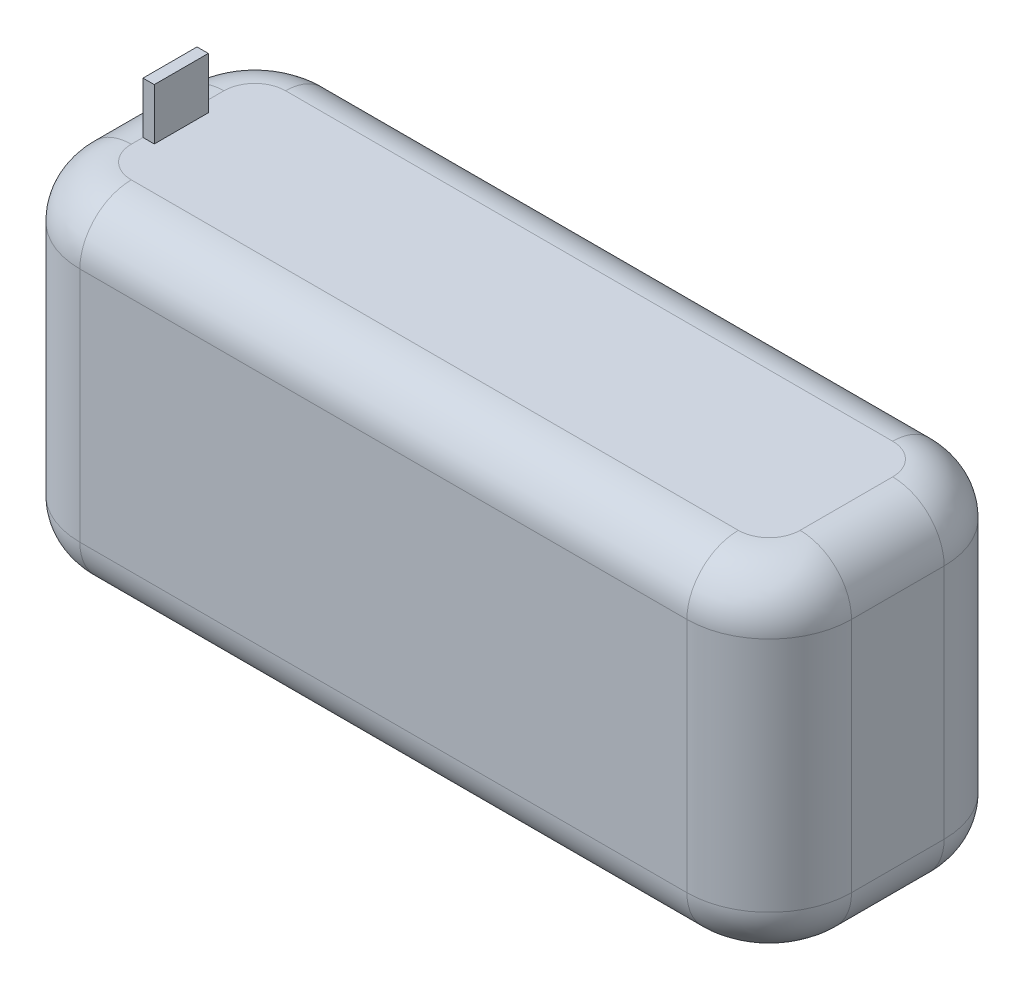
from build123d import *

# Parameters (mm, degrees)
SKETCH1_W           = 75
SKETCH1_H           = 33
BOSS_EXTRUDE1_DEPTH = 25
FILLET1_R           = 5
FILLET2_R           = 8
SKETCH2_W           = 2.553418492
SKETCH2_H           = 5.632377872
BOSS_EXTRUDE2_DEPTH = 5
SKETCH3_W           = 1.096638537
SKETCH3_H           = 5.251652717
BOSS_EXTRUDE3_DEPTH = 5


with BuildPart() as part:
    # Sketch1 → Boss-Extrude1 (new body)
    with BuildSketch(Plane.XY):
        Rectangle(SKETCH1_W, SKETCH1_H)
    extrude(amount=BOSS_EXTRUDE1_DEPTH)

    # Fillet1
    fillet1_edges = [part.edges().sort_by_distance(p)[0] for p in [
        (0, -16.5, 25),
        (0, -16.5, 0),
        (0, 16.5, 0),
        (0, 16.5, 25),
        (37.5, -16.5, 12.5),
        (-37.5, -16.5, 12.5),
        (-37.5, 16.5, 12.5),
        (37.5, 16.5, 12.5),
    ]]
    fillet(fillet1_edges, radius=FILLET1_R)

    # Fillet2
    # the kernel refuses this fillet: 8 mm, written as the material it takes off along each edge
    with BuildSketch(Plane(origin=(-29.5, 16.5, 17), x_dir=(-1, 0, 0), z_dir=(0, 0, -1))) as fillet2_piece_1:
        with BuildLine():
            CenterArc((3, -5), 5, 0, 90)
            Line((8, -5), (8, 0))
            Line((8, 0), (3, 0))
        make_face()
    revolve(axis=Axis((-29.5, 16.5, 17), (0, 1, 0)), revolution_arc=90, mode=Mode.SUBTRACT)
    with BuildSketch(Plane(origin=(-29.5, 16.5, 8), x_dir=(0, 0, -1), z_dir=(1, 0, 0))) as fillet2_piece_2:
        with BuildLine():
            CenterArc((3, -5), 5, 0, 90)
            Line((8, -5), (8, 0))
            Line((8, 0), (3, 0))
        make_face()
    revolve(axis=Axis((-29.5, 16.5, 8), (0, 1, 0)), revolution_arc=90, mode=Mode.SUBTRACT)
    with BuildSketch(Plane(origin=(29.5, 16.5, 17), x_dir=(0, 0, 1), z_dir=(-1, 0, 0))) as fillet2_piece_3:
        with BuildLine():
            CenterArc((3, -5), 5, 0, 90)
            Line((8, -5), (8, 0))
            Line((8, 0), (3, 0))
        make_face()
    revolve(axis=Axis((29.5, 16.5, 17), (0, 1, 0)), revolution_arc=90, mode=Mode.SUBTRACT)
    with BuildSketch(Plane(origin=(29.5, 16.5, 8), x_dir=(1, 0, 0), z_dir=(0, 0, 1))) as fillet2_piece_4:
        with BuildLine():
            CenterArc((3, -5), 5, 0, 90)
            Line((8, -5), (8, 0))
            Line((8, 0), (3, 0))
        make_face()
    revolve(axis=Axis((29.5, 16.5, 8), (0, 1, 0)), revolution_arc=90, mode=Mode.SUBTRACT)
    with BuildSketch(Plane(origin=(-29.5, -16.5, 17), x_dir=(0, 0, 1), z_dir=(1, 0, 0))) as fillet2_piece_5:
        with BuildLine():
            CenterArc((3, -5), 5, 0, 90)
            Line((8, -5), (8, 0))
            Line((8, 0), (3, 0))
        make_face()
    revolve(axis=Axis((-29.5, -16.5, 17), (0, -1, 0)), revolution_arc=90, mode=Mode.SUBTRACT)
    with BuildSketch(Plane(origin=(-29.5, -16.5, 8), x_dir=(-1, 0, 0), z_dir=(0, 0, 1))) as fillet2_piece_6:
        with BuildLine():
            CenterArc((3, -5), 5, 0, 90)
            Line((8, -5), (8, 0))
            Line((8, 0), (3, 0))
        make_face()
    revolve(axis=Axis((-29.5, -16.5, 8), (0, -1, 0)), revolution_arc=90, mode=Mode.SUBTRACT)
    with BuildSketch(Plane(origin=(29.5, -16.5, 17), x_dir=(1, 0, 0), z_dir=(0, 0, -1))) as fillet2_piece_7:
        with BuildLine():
            CenterArc((3, -5), 5, 0, 90)
            Line((8, -5), (8, 0))
            Line((8, 0), (3, 0))
        make_face()
    revolve(axis=Axis((29.5, -16.5, 17), (0, -1, 0)), revolution_arc=90, mode=Mode.SUBTRACT)
    with BuildSketch(Plane(origin=(29.5, -16.5, 8), x_dir=(0, 0, -1), z_dir=(-1, 0, 0))) as fillet2_piece_8:
        with BuildLine():
            CenterArc((3, -5), 5, 0, 90)
            Line((8, -5), (8, 0))
            Line((8, 0), (3, 0))
        make_face()
    revolve(axis=Axis((29.5, -16.5, 8), (0, -1, 0)), revolution_arc=90, mode=Mode.SUBTRACT)
    with BuildSketch(Plane(origin=(37.5, -16.5, 0), x_dir=(0, 0, 1), z_dir=(0, 1, 0)), Plane(origin=(37.5, -16.5, 25), x_dir=(-1, 0, 0), z_dir=(0, 1, 0)), Plane(origin=(-37.5, 16.5, 0), x_dir=(0, 0, 1), z_dir=(0, -1, 0)), Plane(origin=(-37.5, 16.5, 25), x_dir=(1, 0, 0), z_dir=(0, -1, 0))) as fillet2_piece_9:
        with BuildLine():
            CenterArc((FILLET2_R, -FILLET2_R), FILLET2_R, 90, 90)
            Line((0, -FILLET2_R), (0, 0))
            Line((0, 0), (FILLET2_R, 0))
        make_face()
    extrude(amount=33, mode=Mode.SUBTRACT)

    # Sketch2 → Boss-Extrude2 (add)
    with BuildSketch(Plane.XZ.offset(16.5)):
        with Locations((-32.5, 12.5)):
            Rectangle(SKETCH2_W, SKETCH2_H)
    extrude(amount=BOSS_EXTRUDE2_DEPTH)

    # Sketch3 → Boss-Extrude3 (add)
    with BuildSketch(Plane(origin=(0, 16.5, 0), x_dir=(1, 0, 0), z_dir=(0, 1, 0))):
        with Locations((-31.951680732, -13.240900807)):
            Rectangle(SKETCH3_W, SKETCH3_H)
    extrude(amount=BOSS_EXTRUDE3_DEPTH)


solid = part.part
